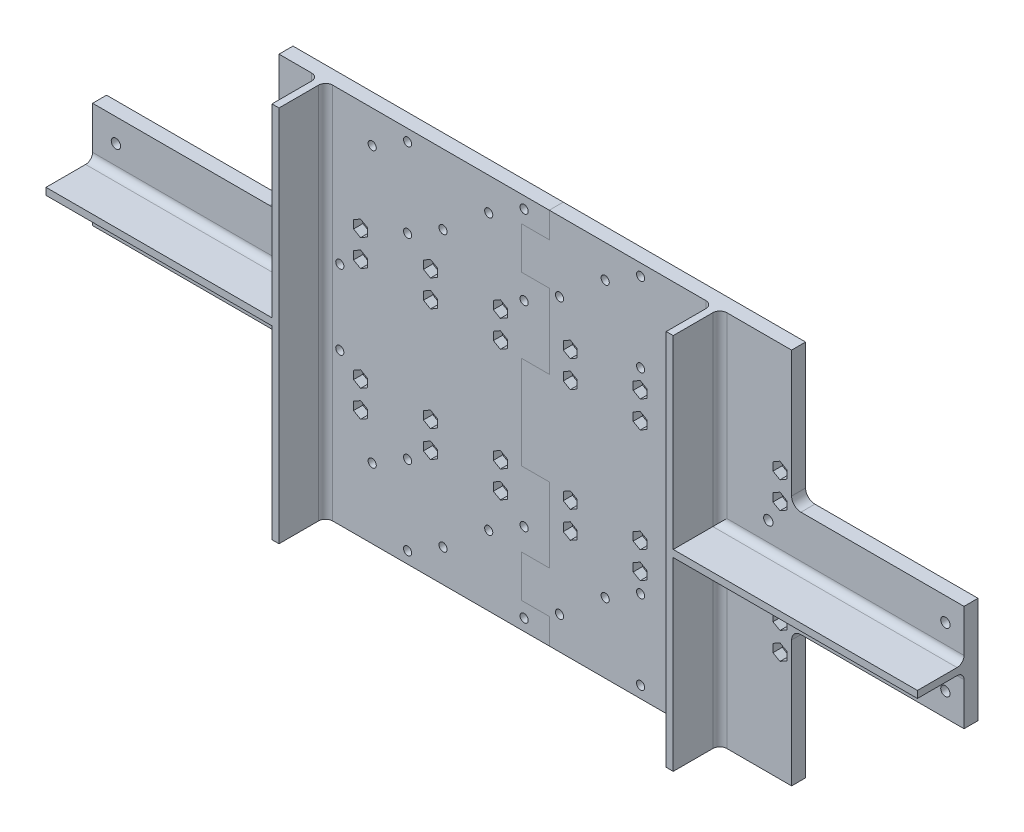
from build123d import *

# Parameters (mm, degrees)
BOSS_EXTRUDE1_DEPTH    = 3
BOSS_EXTRUDE2_DEPTH    = 20
SKETCH4_R              = 1.75
CUT_EXTRUDE1_DEPTH     = 205.768161588
FILLET1_R              = 4
FILLET2_R              = 3
CUT_EXTRUDE2_REACH     = 207.441
SKETCH5_R              = 2
SKETCH6_R              = 1.75
CUT_EXTRUDE3_DEPTH     = 205.768161588
SKETCH8_R              = 1.75
CUT_EXTRUDE5_DEPTH     = 205.768161588
SKETCH9_R              = 1.75
CUT_EXTRUDE6_DEPTH     = 205.768161588
CUT_EXTRUDE7_DEPTH     = 4
SPLIT1_SURFACE_1_BACK  = 409.407
SPLIT1_SURFACE_1_DEPTH = 818.814
SPLIT1_SURFACE_2_BACK  = 409.407
SPLIT1_SURFACE_2_DEPTH = 818.814


with BuildPart() as part:
    # Sketch2 → Boss-Extrude1 (new, symmetric)
    with BuildSketch(Plane.XY):
        Polygon((-187, 22.75), (-187, -22.75), (-107, -22.75), (-107, -81), (113, -81), (113, -22.75), (187, -22.75), (187, 22.75), (113, 22.75), (113, 81), (-107, 81), (-107, 22.75), align=None)
    extrude(amount=BOSS_EXTRUDE1_DEPTH, both=True)

    # Sketch3 → Boss-Extrude2 (add)
    with BuildSketch(Plane.XY.offset(3)):
        Polygon((-187, -1.5), (-90, -1.5), (-90, -81), (-87, -81), (-87, 81), (-90, 81), (-90, 1.5), (-187, 1.5), align=None)
        Polygon((82.2, -81), (82.2, -1.5), (187, -1.5), (187, 1.5), (82.2, 1.5), (82.2, 81), (79.2, 81), (79.2, -81), align=None)
    extrude(amount=BOSS_EXTRUDE2_DEPTH)

    # Sketch4 → Cut-Extrude1 (cut, through all)
    with BuildSketch(Plane.XY.offset(3)):
        with Locations((-36.6, -67)):
            Circle(SKETCH4_R)
        with Locations((-67, -51)):
            Circle(SKETCH4_R)
        with Locations((13.4, -67)):
            Circle(SKETCH4_R)
        with Locations((-17, -51)):
            Circle(SKETCH4_R)
        with Locations((63.4, -67)):
            Circle(SKETCH4_R)
        with Locations((33, -51)):
            Circle(SKETCH4_R)
        with Locations((33, 67)):
            Circle(SKETCH4_R)
        with Locations((63.4, 51)):
            Circle(SKETCH4_R)
        with Locations((13.4, 51)):
            Circle(SKETCH4_R)
        with Locations((-17, 67)):
            Circle(SKETCH4_R)
        with Locations((-36.6, 51)):
            Circle(SKETCH4_R)
        with Locations((-67, 67)):
            Circle(SKETCH4_R)
    extrude(amount=-CUT_EXTRUDE1_DEPTH, mode=Mode.SUBTRACT)

    # Fillet1
    fillet1_edges = [part.edges().sort_by_distance(p)[0] for p in [
        (-107, 22.75, 0),
        (-107, -22.75, 0),
        (113, -22.75, 0),
        (113, 22.75, 0),
    ]]
    fillet(fillet1_edges, radius=FILLET1_R)

    # Fillet2
    fillet2_edges = [part.edges().sort_by_distance(p)[0] for p in [
        (-90, 41.25, 3),
        (-138.5, 1.5, 3),
        (-138.5, -1.5, 3),
        (-90, -41.25, 3),
        (82.2, -41.25, 3),
        (134.6, -1.5, 3),
        (134.6, 1.5, 3),
        (82.2, 41.25, 3),
        (-87, 0, 3),
        (79.2, 0, 3),
    ]]
    fillet(fillet2_edges, radius=FILLET2_R)

    # Sketch5 → Cut-Extrude2 (cut, up to next)
    with BuildSketch(Plane(origin=(0, 0, -3), x_dir=(-1, 0, 0), z_dir=(0, 0, -1)), mode=Mode.PRIVATE) as cut_extrude2_sk1:
        with Locations((-103, -12.75)):
            Circle(SKETCH5_R)
    cut_extrude2_tool1 = extrude(cut_extrude2_sk1.sketch, amount=-CUT_EXTRUDE2_REACH, mode=Mode.PRIVATE) & part.part
    # Sketch5 → Cut-Extrude2 (cut, up to next)
    with BuildSketch(Plane(origin=(0, 0, -3), x_dir=(-1, 0, 0), z_dir=(0, 0, -1)), mode=Mode.PRIVATE) as cut_extrude2_sk2:
        with Locations((-103, 12.75)):
            Circle(SKETCH5_R)
    cut_extrude2_tool2 = extrude(cut_extrude2_sk2.sketch, amount=-CUT_EXTRUDE2_REACH, mode=Mode.PRIVATE) & part.part
    # Sketch5 → Cut-Extrude2 (cut, up to next)
    with BuildSketch(Plane(origin=(0, 0, -3), x_dir=(-1, 0, 0), z_dir=(0, 0, -1)), mode=Mode.PRIVATE) as cut_extrude2_sk3:
        with Locations((-179, 12.75)):
            Circle(SKETCH5_R)
    cut_extrude2_tool3 = extrude(cut_extrude2_sk3.sketch, amount=-CUT_EXTRUDE2_REACH, mode=Mode.PRIVATE) & part.part
    # Sketch5 → Cut-Extrude2 (cut, up to next)
    with BuildSketch(Plane(origin=(0, 0, -3), x_dir=(-1, 0, 0), z_dir=(0, 0, -1)), mode=Mode.PRIVATE) as cut_extrude2_sk4:
        with Locations((-179, -12.75)):
            Circle(SKETCH5_R)
    cut_extrude2_tool4 = extrude(cut_extrude2_sk4.sketch, amount=-CUT_EXTRUDE2_REACH, mode=Mode.PRIVATE) & part.part
    # Sketch5 → Cut-Extrude2 (cut, up to next)
    with BuildSketch(Plane(origin=(0, 0, -3), x_dir=(-1, 0, 0), z_dir=(0, 0, -1)), mode=Mode.PRIVATE) as cut_extrude2_sk5:
        with Locations((177, 12.75)):
            Circle(SKETCH5_R)
    cut_extrude2_tool5 = extrude(cut_extrude2_sk5.sketch, amount=-CUT_EXTRUDE2_REACH, mode=Mode.PRIVATE) & part.part
    # Sketch5 → Cut-Extrude2 (cut, up to next)
    with BuildSketch(Plane(origin=(0, 0, -3), x_dir=(-1, 0, 0), z_dir=(0, 0, -1)), mode=Mode.PRIVATE) as cut_extrude2_sk6:
        with Locations((177, -12.75)):
            Circle(SKETCH5_R)
    cut_extrude2_tool6 = extrude(cut_extrude2_sk6.sketch, amount=-CUT_EXTRUDE2_REACH, mode=Mode.PRIVATE) & part.part
    # Sketch5 → Cut-Extrude2 (cut, up to next)
    with BuildSketch(Plane(origin=(0, 0, -3), x_dir=(-1, 0, 0), z_dir=(0, 0, -1)), mode=Mode.PRIVATE) as cut_extrude2_sk7:
        with Locations((101, -12.75)):
            Circle(SKETCH5_R)
    cut_extrude2_tool7 = extrude(cut_extrude2_sk7.sketch, amount=-CUT_EXTRUDE2_REACH, mode=Mode.PRIVATE) & part.part
    # Sketch5 → Cut-Extrude2 (cut, up to next)
    with BuildSketch(Plane(origin=(0, 0, -3), x_dir=(-1, 0, 0), z_dir=(0, 0, -1)), mode=Mode.PRIVATE) as cut_extrude2_sk8:
        with Locations((101, 12.75)):
            Circle(SKETCH5_R)
    cut_extrude2_tool8 = extrude(cut_extrude2_sk8.sketch, amount=-CUT_EXTRUDE2_REACH, mode=Mode.PRIVATE) & part.part
    add(cut_extrude2_tool1.solids().sort_by_distance((103, -12.75, -3))[0], mode=Mode.SUBTRACT)
    add(cut_extrude2_tool2.solids().sort_by_distance((103, 12.75, -3))[0], mode=Mode.SUBTRACT)
    add(cut_extrude2_tool3.solids().sort_by_distance((179, 12.75, -3))[0], mode=Mode.SUBTRACT)
    add(cut_extrude2_tool4.solids().sort_by_distance((179, -12.75, -3))[0], mode=Mode.SUBTRACT)
    add(cut_extrude2_tool5.solids().sort_by_distance((-177, 12.75, -3))[0], mode=Mode.SUBTRACT)
    add(cut_extrude2_tool6.solids().sort_by_distance((-177, -12.75, -3))[0], mode=Mode.SUBTRACT)
    add(cut_extrude2_tool7.solids().sort_by_distance((-101, -12.75, -3))[0], mode=Mode.SUBTRACT)
    add(cut_extrude2_tool8.solids().sort_by_distance((-101, 12.75, -3))[0], mode=Mode.SUBTRACT)

    # Sketch6 → Cut-Extrude3 (cut, through all)
    with BuildSketch(Plane.XY.offset(3)):
        with Locations((-51.8, -76)):
            Circle(SKETCH6_R)
        with Locations((-51.8, -42)):
            Circle(SKETCH6_R)
        with Locations((-1.8, -76)):
            Circle(SKETCH6_R)
        with Locations((-1.8, -42)):
            Circle(SKETCH6_R)
        with Locations((48.2, -76)):
            Circle(SKETCH6_R)
        with Locations((48.2, -42)):
            Circle(SKETCH6_R)
        with Locations((48.2, 42)):
            Circle(SKETCH6_R)
        with Locations((48.2, 76)):
            Circle(SKETCH6_R)
        with Locations((-1.8, 42)):
            Circle(SKETCH6_R)
        with Locations((-1.8, 76)):
            Circle(SKETCH6_R)
        with Locations((-51.8, 42)):
            Circle(SKETCH6_R)
        with Locations((-51.8, 76)):
            Circle(SKETCH6_R)
    extrude(amount=-CUT_EXTRUDE3_DEPTH, mode=Mode.SUBTRACT)

    # Sketch8 → Cut-Extrude5 (cut, through all)
    with BuildSketch(Plane.XY.offset(3)):
        with Locations((-80.9, -16)):
            Circle(SKETCH8_R)
        with Locations((-80.9, 16)):
            Circle(SKETCH8_R)
        with Locations((73.1, 16)):
            Circle(SKETCH8_R)
        with Locations((73.1, -16)):
            Circle(SKETCH8_R)
    extrude(amount=-CUT_EXTRUDE5_DEPTH, mode=Mode.SUBTRACT)

    # Sketch9 → Cut-Extrude6 (cut, through all)
    with BuildSketch(Plane.XY.offset(3)):
        with Locations((-12, -33.75)):
            Circle(SKETCH9_R)
        with Locations((-42, -33.75)):
            Circle(SKETCH9_R)
        with Locations((-72, -33.75)):
            Circle(SKETCH9_R)
        with Locations((-102, -33.75)):
            Circle(SKETCH9_R)
        with Locations((108, -33.75)):
            Circle(SKETCH9_R)
        with Locations((48, -33.75)):
            Circle(SKETCH9_R)
        with Locations((18, -33.75)):
            Circle(SKETCH9_R)
        with Locations((18, -22.25)):
            Circle(SKETCH9_R)
        with Locations((48, -22.25)):
            Circle(SKETCH9_R)
        with Locations((108, -22.25)):
            Circle(SKETCH9_R)
        with Locations((-102, -22.25)):
            Circle(SKETCH9_R)
        with Locations((-72, -22.25)):
            Circle(SKETCH9_R)
        with Locations((-42, -22.25)):
            Circle(SKETCH9_R)
        with Locations((-12, -22.25)):
            Circle(SKETCH9_R)
        with Locations((-12, 22.25)):
            Circle(SKETCH9_R)
        with Locations((-42, 22.25)):
            Circle(SKETCH9_R)
        with Locations((-72, 22.25)):
            Circle(SKETCH9_R)
        with Locations((-102, 22.25)):
            Circle(SKETCH9_R)
        with Locations((108, 22.25)):
            Circle(SKETCH9_R)
        with Locations((48, 22.25)):
            Circle(SKETCH9_R)
        with Locations((18, 22.25)):
            Circle(SKETCH9_R)
        with Locations((18, 33.75)):
            Circle(SKETCH9_R)
        with Locations((48, 33.75)):
            Circle(SKETCH9_R)
        with Locations((108, 33.75)):
            Circle(SKETCH9_R)
        with Locations((-102, 33.75)):
            Circle(SKETCH9_R)
        with Locations((-72, 33.75)):
            Circle(SKETCH9_R)
        with Locations((-42, 33.75)):
            Circle(SKETCH9_R)
        with Locations((-12, 33.75)):
            Circle(SKETCH9_R)
    extrude(amount=-CUT_EXTRUDE6_DEPTH, mode=Mode.SUBTRACT)

    # Sketch10 → Cut-Extrude7 (cut)
    with BuildSketch(Plane.XY.offset(3)):
        Polygon((-99, -35.482050808), (-99, -32.017949192), (-102, -30.285898385), (-105, -32.017949192), (-105, -35.482050808), (-102, -37.214101615), align=None)
        Polygon((-69, -35.482050808), (-69, -32.017949192), (-72, -30.285898385), (-75, -32.017949192), (-75, -35.482050808), (-72, -37.214101615), align=None)
        Polygon((-39, -35.482050808), (-39, -32.017949192), (-42, -30.285898385), (-45, -32.017949192), (-45, -35.482050808), (-42, -37.214101615), align=None)
        Polygon((-9, -35.482050808), (-9, -32.017949192), (-12, -30.285898385), (-15, -32.017949192), (-15, -35.482050808), (-12, -37.214101615), align=None)
        Polygon((51, -32.017949192), (51, -35.482050808), (48, -37.214101615), (45, -35.482050808), (45, -32.017949192), (48, -30.285898385), align=None)
        Polygon((15, -32.017949192), (18, -30.285898385), (21, -32.017949192), (21, -35.482050808), (18, -37.214101615), (15, -35.482050808), align=None)
        Polygon((51, -23.982050808), (51, -20.517949192), (48, -18.785898385), (45, -20.517949192), (45, -23.982050808), (48, -25.714101615), align=None)
        Polygon((105, -23.982050808), (108, -25.714101615), (111, -23.982050808), (111, -20.517949192), (108, -18.785898385), (105, -20.517949192), align=None)
        Polygon((105, -32.017949192), (108, -30.285898385), (111, -32.017949192), (111, -35.482050808), (108, -37.214101615), (105, -35.482050808), align=None)
        Polygon((-45, -20.517949192), (-42, -18.785898385), (-39, -20.517949192), (-39, -23.982050808), (-42, -25.714101615), (-45, -23.982050808), align=None)
        Polygon((-15, -20.517949192), (-12, -18.785898385), (-9, -20.517949192), (-9, -23.982050808), (-12, -25.714101615), (-15, -23.982050808), align=None)
        Polygon((21, -20.517949192), (18, -18.785898385), (15, -20.517949192), (15, -23.982050808), (18, -25.714101615), (21, -23.982050808), align=None)
        Polygon((-105, -23.982050808), (-105, -20.517949192), (-102, -18.785898385), (-99, -20.517949192), (-99, -23.982050808), (-102, -25.714101615), align=None)
        Polygon((-72, -25.714101615), (-75, -23.982050808), (-75, -20.517949192), (-72, -18.785898385), (-69, -20.517949192), (-69, -23.982050808), align=None)
        Polygon((-69, 20.517949192), (-69, 23.982050808), (-72, 25.714101615), (-75, 23.982050808), (-75, 20.517949192), (-72, 18.785898385), align=None)
        Polygon((-75, 35.482050808), (-72, 37.214101615), (-69, 35.482050808), (-69, 32.017949192), (-72, 30.285898385), (-75, 32.017949192), align=None)
        Polygon((-99, 20.517949192), (-99, 23.982050808), (-102, 25.714101615), (-105, 23.982050808), (-105, 20.517949192), (-102, 18.785898385), align=None)
        Polygon((-105, 35.482050808), (-102, 37.214101615), (-99, 35.482050808), (-99, 32.017949192), (-102, 30.285898385), (-105, 32.017949192), align=None)
        Polygon((-12, 18.785898385), (-9, 20.517949192), (-9, 23.982050808), (-12, 25.714101615), (-15, 23.982050808), (-15, 20.517949192), align=None)
        Polygon((-15, 35.482050808), (-12, 37.214101615), (-9, 35.482050808), (-9, 32.017949192), (-12, 30.285898385), (-15, 32.017949192), align=None)
        Polygon((-39, 20.517949192), (-39, 23.982050808), (-42, 25.714101615), (-45, 23.982050808), (-45, 20.517949192), (-42, 18.785898385), align=None)
        Polygon((-45, 32.017949192), (-45, 35.482050808), (-42, 37.214101615), (-39, 35.482050808), (-39, 32.017949192), (-42, 30.285898385), align=None)
        Polygon((45, 23.982050808), (48, 25.714101615), (51, 23.982050808), (51, 20.517949192), (48, 18.785898385), (45, 20.517949192), align=None)
        Polygon((51, 32.017949192), (51, 35.482050808), (48, 37.214101615), (45, 35.482050808), (45, 32.017949192), (48, 30.285898385), align=None)
        Polygon((15, 23.982050808), (18, 25.714101615), (21, 23.982050808), (21, 20.517949192), (18, 18.785898385), (15, 20.517949192), align=None)
        Polygon((21, 32.017949192), (21, 35.482050808), (18, 37.214101615), (15, 35.482050808), (15, 32.017949192), (18, 30.285898385), align=None)
        Polygon((105, 23.982050808), (108, 25.714101615), (111, 23.982050808), (111, 20.517949192), (108, 18.785898385), (105, 20.517949192), align=None)
        Polygon((111, 32.017949192), (111, 35.482050808), (108, 37.214101615), (105, 35.482050808), (105, 32.017949192), (108, 30.285898385), align=None)
    extrude(amount=-CUT_EXTRUDE7_DEPTH, mode=Mode.SUBTRACT)


with BuildPart() as body_2:
    # Split1: the piece behind the surface
    add(part.part)
    # Split1 surface: a surface, the sketch's curves swept straight by 818.814 mm
    with BuildLine(Plane.XY.offset(3).offset(-SPLIT1_SURFACE_1_BACK), mode=Mode.PRIVATE) as split1_surface_1_path:
        Line((9, -81), (9, -70))
        Line((9, -70), (-3, -70))
        Line((-3, -70), (-3, -52))
        Line((-3, -52), (9, -52))
        Line((9, -52), (9, -20))
        Line((9, -20), (-3, -20))
        Line((-3, -20), (-3, 20))
        Line((-3, 20), (9, 20))
        Line((9, 20), (9, 52))
        Line((9, 52), (-3, 52))
        Line((-3, 52), (-3, 70))
        Line((-3, 70), (9, 70))
        Line((9, 70), (9, 81))
    split1_surface_1 = Shell.extrude(split1_surface_1_path.wire(), (0 * SPLIT1_SURFACE_1_DEPTH, 0 * SPLIT1_SURFACE_1_DEPTH, 1 * SPLIT1_SURFACE_1_DEPTH))
    split(bisect_by=split1_surface_1, keep=Keep.BOTTOM)


with BuildPart() as part_1:
    add(part.part)

    # Split1: split by a surface, the side it looks to stays
    # Split1 surface: a surface, the sketch's curves swept straight by 818.814 mm
    with BuildLine(Plane.XY.offset(3).offset(-SPLIT1_SURFACE_2_BACK), mode=Mode.PRIVATE) as split1_surface_2_path:
        Line((9, -81), (9, -70))
        Line((9, -70), (-3, -70))
        Line((-3, -70), (-3, -52))
        Line((-3, -52), (9, -52))
        Line((9, -52), (9, -20))
        Line((9, -20), (-3, -20))
        Line((-3, -20), (-3, 20))
        Line((-3, 20), (9, 20))
        Line((9, 20), (9, 52))
        Line((9, 52), (-3, 52))
        Line((-3, 52), (-3, 70))
        Line((-3, 70), (9, 70))
        Line((9, 70), (9, 81))
    split1_surface_2 = Shell.extrude(split1_surface_2_path.wire(), (0 * SPLIT1_SURFACE_2_DEPTH, 0 * SPLIT1_SURFACE_2_DEPTH, 1 * SPLIT1_SURFACE_2_DEPTH))
    split(bisect_by=split1_surface_2, keep=Keep.TOP)


solid = Compound([body_2.part, part_1.part])
